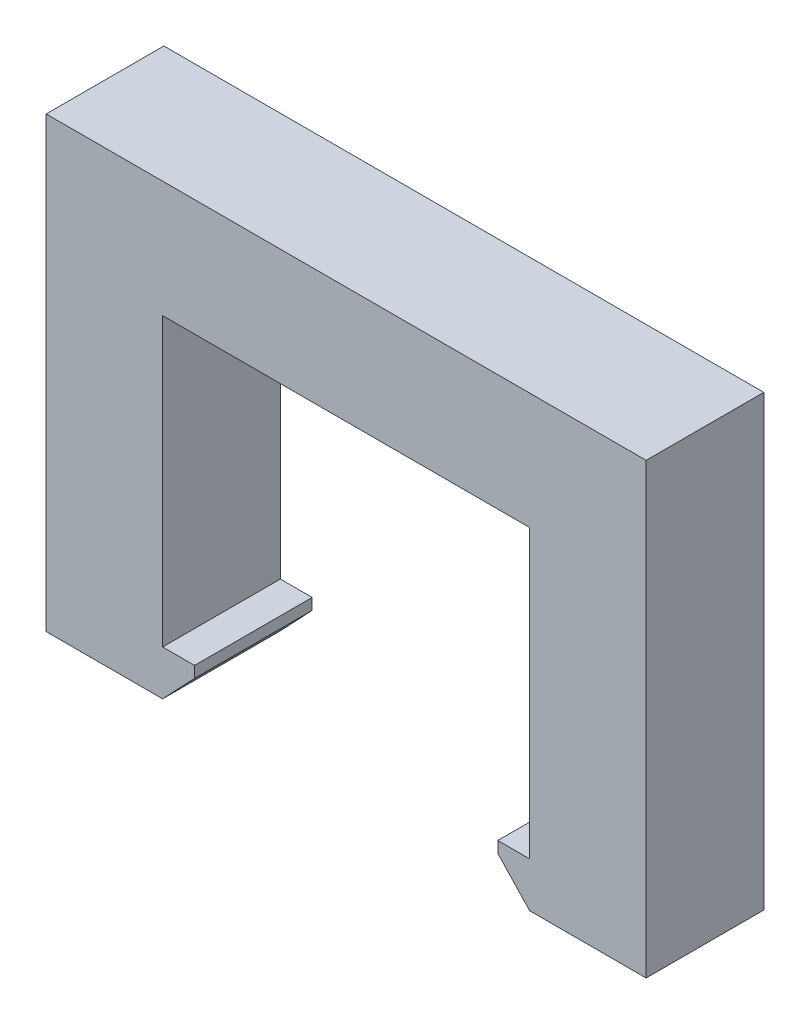
from build123d import *

# Parameters (mm, degrees)
BOSS_EXTRUDE1_DEPTH = 12.8016


with BuildPart() as part:
    # Sketch1 → Boss-Extrude1 (new body)
    with BuildSketch(Plane(origin=(0, 0, 0), x_dir=(0, 1, 0), z_dir=(0, 0, 1))):
        Polygon((-12.667724742, 19.9644), (-12.667724742, -19.9644), (-43.884324742, -19.9644), (-43.884324742, -16.4973), (-45.105912497, -16.4973), (-48.770675759, -19.9644), (-48.770675759, -32.632124742), (0, -32.632124742), (0, 0), (0, 32.632124742), (-48.770675759, 32.632124742), (-48.770675759, 19.9644), (-45.105912497, 16.4973), (-43.884324742, 16.4973), (-43.884324742, 19.9644), align=None)
    extrude(amount=BOSS_EXTRUDE1_DEPTH)


solid = part.part
